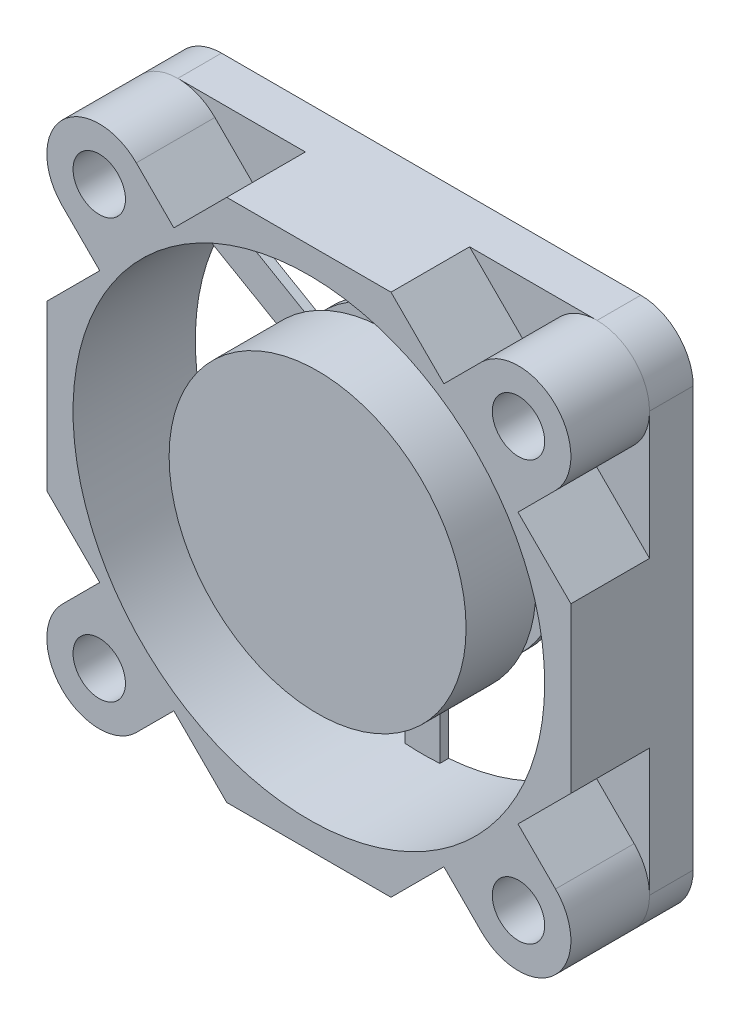
from build123d import *
from build123d.topology import SkipClean

# Parameters (mm, degrees)
SKETCH_1_W          = 30
SKETCH_1_H          = 30
SKETCH_1_R          = 1.5
EXTRUDE_1_DEPTH     = 2.5
SKETCH_2_R          = 1.5
SKETCH_2_R_2        = 13.5
EXTRUDE_2_DEPTH     = 4.5
FILLET_2_R          = 3
CUT_EXTRUDE_START   = -2
SKETCH_3_R          = 13.5
CUT_EXTRUDE_1_DEPTH = 2
SKETCH_4_R          = 8.5
SKETCH_4_R_2        = 7.5
EXTRUDE_3_DEPTH     = 4
SKETCH_5_R          = 8.5
EXTRUDE_4_DEPTH     = 2


with BuildPart() as part:
    # Эскиз1 → Бобышка-Вытянуть1 (new body)
    with BuildSketch(Plane.XY):
        Rectangle(SKETCH_1_W, SKETCH_1_H)
        with Locations((-12, 12)):
            Circle(SKETCH_1_R, mode=Mode.SUBTRACT)
        with Locations((12, 12)):
            Circle(SKETCH_1_R, mode=Mode.SUBTRACT)
        with Locations((12, -12)):
            Circle(SKETCH_1_R, mode=Mode.SUBTRACT)
        with Locations((-12, -12)):
            Circle(SKETCH_1_R, mode=Mode.SUBTRACT)
        with BuildLine():
            Line((-1, -7.937253933), (-1, -13.462912018))
            ThreePointArc((-1, -13.462912018), (-11.691342951, -6.75), (-12.159223816, 5.865430605))
            Line((-12.159223816, 5.865430605), (-7.373863542, 3.102601563))
            ThreePointArc((-7.373863542, 3.102601563), (-6.92820323, -4), (-1, -7.937253933))
        make_face(mode=Mode.SUBTRACT)
        with BuildLine():
            Line((1, -7.937253933), (1, -13.462912018))
            ThreePointArc((1, -13.462912018), (11.691342951, -6.75), (12.159223816, 5.865430605))
            Line((12.159223816, 5.865430605), (7.373863542, 3.102601563))
            ThreePointArc((7.373863542, 3.102601563), (6.92820323, -4), (1, -7.937253933))
        make_face(mode=Mode.SUBTRACT)
        with BuildLine():
            Line((-6.373863542, 4.83465237), (-11.159223816, 7.597481413))
            ThreePointArc((-11.159223816, 7.597481413), (0, 13.5), (11.159223816, 7.597481413))
            Line((11.159223816, 7.597481413), (6.373863542, 4.83465237))
            ThreePointArc((6.373863542, 4.83465237), (0, 8), (-6.373863542, 4.83465237))
        make_face(mode=Mode.SUBTRACT)
    extrude(amount=EXTRUDE_1_DEPTH)

    # Эскиз2 → Бобышка-Вытянуть2 (add)
    with SkipClean():  # the faces are left unmerged after this step: merging them gives an invalid solid
        with BuildSketch(Plane.XY.offset(2.5)):
            with BuildLine():
                Line((-9.878679656, 14.121320344), (-7.729123809, 11.971764496))
                Line((-7.729123809, 11.971764496), (-4.700888305, 15))
                Line((-4.700888305, 15), (4.700888305, 15))
                Line((4.700888305, 15), (7.729123809, 11.971764496))
                Line((7.729123809, 11.971764496), (9.878679656, 14.121320344))
                ThreePointArc((9.878679656, 14.121320344), (14.121320344, 14.121320344), (14.121320344, 9.878679656))
                Line((14.121320344, 9.878679656), (11.971764496, 7.729123809))
                Line((11.971764496, 7.729123809), (15, 4.700888305))
                Line((15, 4.700888305), (15, -4.700888305))
                Line((15, -4.700888305), (11.971764496, -7.729123809))
                Line((11.971764496, -7.729123809), (14.121320344, -9.878679656))
                ThreePointArc((14.121320344, -9.878679656), (14.121320344, -14.121320344), (9.878679656, -14.121320344))
                Line((9.878679656, -14.121320344), (7.729123809, -11.971764496))
                Line((7.729123809, -11.971764496), (4.700888305, -15))
                Line((4.700888305, -15), (-4.700888305, -15))
                Line((-4.700888305, -15), (-7.729123809, -11.971764496))
                Line((-7.729123809, -11.971764496), (-9.878679656, -14.121320344))
                ThreePointArc((-9.878679656, -14.121320344), (-14.121320344, -14.121320344), (-14.121320344, -9.878679656))
                Line((-14.121320344, -9.878679656), (-11.971764496, -7.729123809))
                Line((-11.971764496, -7.729123809), (-15, -4.700888305))
                Line((-15, -4.700888305), (-15, 4.700888305))
                Line((-15, 4.700888305), (-11.971764496, 7.729123809))
                Line((-11.971764496, 7.729123809), (-14.121320344, 9.878679656))
                ThreePointArc((-14.121320344, 9.878679656), (-14.121320344, 14.121320344), (-9.878679656, 14.121320344))
            make_face()
            with Locations((-12, 12)):
                Circle(SKETCH_2_R, mode=Mode.SUBTRACT)
            with Locations((12, 12)):
                Circle(SKETCH_2_R, mode=Mode.SUBTRACT)
            with Locations((12, -12)):
                Circle(SKETCH_2_R, mode=Mode.SUBTRACT)
            with Locations((-12, -12)):
                Circle(SKETCH_2_R, mode=Mode.SUBTRACT)
            with Locations(Location((0, 0, 0), (0, 0, 154.248022667))):
                Circle(SKETCH_2_R_2, mode=Mode.SUBTRACT)
        extrude(amount=EXTRUDE_2_DEPTH)

    # Скругление2
    fillet_2_edges = [part.edges().sort_by_distance(p)[0] for p in [
        (-15, -15, 1.25),
        (15, -15, 1.25),
        (15, 15, 1.25),
        (-15, 15, 1.25),
    ]]
    fillet(fillet_2_edges, radius=FILLET_2_R - 0.0001)  # a hair under: the kernel refuses the full size

    # Эскиз3 → Вырез-Вытянуть1 (cut)
    with BuildSketch(Plane.XY.offset(2.5).offset(CUT_EXTRUDE_START)):
        with Locations(Location((0, 0, 0), (0, 0, 154.248022667))):
            Circle(SKETCH_3_R)
    extrude(amount=CUT_EXTRUDE_1_DEPTH, mode=Mode.SUBTRACT)


with BuildPart() as body_2:
    # Эскиз4 → Бобышка-Вытянуть3 (new body)
    with BuildSketch(Plane.XY.offset(2.5)):
        Circle(SKETCH_4_R)
        Circle(SKETCH_4_R_2, mode=Mode.SUBTRACT)
    extrude(amount=EXTRUDE_3_DEPTH)

    # Эскиз5 → Бобышка-Вытянуть4 (add)
    with BuildSketch(Plane.XY.offset(6.5)):
        Circle(SKETCH_5_R)
    extrude(amount=-EXTRUDE_4_DEPTH)


solid = Compound([part.part, body_2.part])
